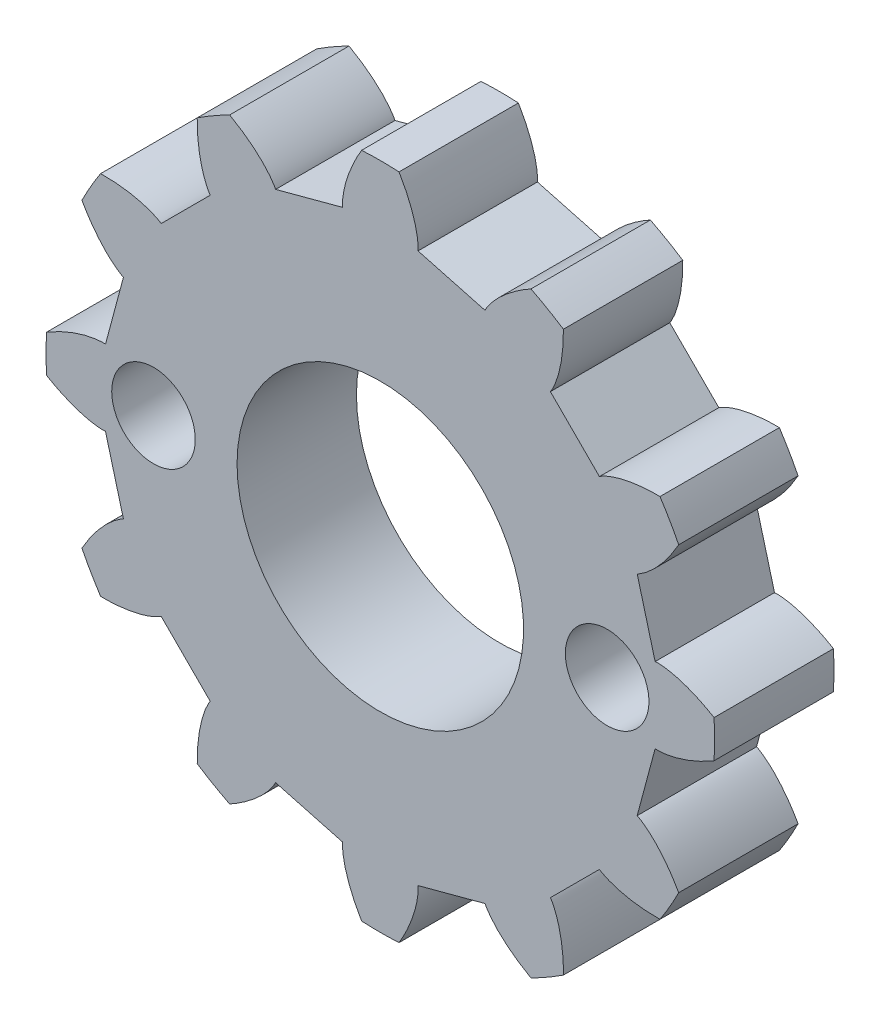
from build123d import *

# Parameters (mm, degrees)
SKETCH1_W               = 14
SKETCH1_H               = 5
CUT_EXTRUDE2_DEPTH      = 6
CIRPATTERN1_COUNT       = 12
CUT_EXTRUDE4_DEPTH      = 7
CUT_EXTRUDE4_DEPTH_BACK = 7
SKETCH3_R               = 6
SKETCH3_R_2             = 1.75


with BuildPart() as part:
    # Sketch1 → Revolve1 (revolve)
    with BuildSketch(Plane(origin=(0, 0, 0), x_dir=(1, 0, 0), z_dir=(0, 1, 0))):
        with Locations((7, -2.5)):
            Rectangle(SKETCH1_W, SKETCH1_H)
    revolve(axis=Axis((0, 0, 1), (0, 0, 1)))

    # Sketch2 → Cut-Extrude2 (cut, symmetric)
    with BuildSketch(Plane.XY):
        with BuildLine():
            add(Edge.make_bspline(
                [(11.509794645, 1.580267483), (11.513649577, 1.58074099), (11.524482374, 1.581899197), (11.545040271, 1.583417613), (11.578673885, 1.584939637), (11.621640783, 1.585473177), (11.677272094, 1.58454666), (11.742898568, 1.581376048), (11.815076545, 1.575712999), (11.893622206, 1.56720183), (11.971967533, 1.556633666), (12.050075991, 1.544160387), (12.127824076, 1.529994452), (12.221897823, 1.510781841), (12.334535508, 1.484891422), (12.465863184, 1.450486577), (12.614354754, 1.406585856), (12.765087082, 1.356650882), (12.912870643, 1.303254669), (13.061452614, 1.244438209), (13.204685667, 1.184082676), (13.352570159, 1.116449268), (13.488631947, 1.05150154), (13.639954485, 0.973312665), (13.761758266, 0.908625047), (13.886564813, 0.837313837), (13.947154846, 0.801945656), (13.978053561, 0.78359275)],
                knots=[2.5e-08, 2.5e-08, 2.5e-08, 2.5e-08, 2.5e-08, 0.005376749, 0.015083688, 0.02853182, 0.04661014, 0.064854849, 0.092110525, 0.119476176, 0.146842496, 0.174208854, 0.201574956, 0.228941013, 0.256307345, 0.307035032, 0.361767352, 0.416499661, 0.471231937, 0.525964282, 0.580696616, 0.635428982, 0.690161387, 0.744893688, 0.799626082, 0.854358408, 0.909090932, 0.909090932, 0.909090932, 0.909090932, 0.909090932], degree=4))
            add(Edge.make_bspline(
                [(13.978053561, 0.78359275), (14.552796942, 0.815812142), (15.669145229, 0.878393273), (18.676568536, 1.046985775), (20.905715815, 1.171949067), (24.231493422, 1.358388125), (26.780700493, 1.501293581), (29.542274367, 1.656104062), (31.85108462, 1.785533164), (34.272002701, 1.921246895), (36.589305557, 2.051152082), (38.979012727, 2.185116167), (41.345689012, 2.317789168), (43.584914052, 2.443317408), (45.771704582, 2.565906232), (47.819138341, 2.680682885), (49.738724778, 2.788292571), (51.542013805, 2.889382767), (53.306863976, 2.988318126), (54.763267689, 3.069962352), (56.42798926, 3.163284623), (57.609113149, 3.229496996), (59.014479317, 3.308280118), (59.581989126, 3.34009403), (59.905824187, 3.35824783)],
                knots=[0.083333333, 0.083333333, 0.083333333, 0.083333333, 0.083333333, 0.133389614, 0.184399802, 0.242015797, 0.296483898, 0.342668905, 0.388178228, 0.431557158, 0.47049247, 0.51459478, 0.558617598, 0.603642018, 0.642942995, 0.676973634, 0.717013889, 0.753119277, 0.780567956, 0.81054449, 0.840687958, 0.866681929, 0.88846281, 0.916666667, 0.916666667, 0.916666667, 0.916666667, 0.916666667], degree=4))
            add(Edge.make_bspline(
                [(59.905824187, 3.35824783), (59.898967791, 3.480555087), (59.884276336, 3.725468848), (59.847233627, 4.309040306), (59.809100404, 4.783373046), (59.755229129, 5.435549269), (59.701559503, 5.981191957), (59.638601048, 6.589752226), (59.572034189, 7.159755005), (59.498507768, 7.751358683), (59.41994969, 8.329731781), (59.314220697, 9.059347662), (59.176123254, 9.929150916), (58.998380892, 10.943523417), (58.77252213, 12.097343477), (58.524247729, 13.246943123), (58.253195349, 14.391604883), (57.960269702, 15.530000537), (57.644239062, 16.66393558), (57.307452375, 17.788817065), (56.946364624, 18.911335324), (56.567166837, 20.019166966), (56.160033919, 21.131575399), (55.741583374, 22.215568594), (55.284609852, 23.324904517), (54.835737132, 24.367184365), (54.377030446, 25.365076998), (54.047150754, 26.063113209), (53.722661816, 26.718514901), (53.614305327, 26.935234738), (53.559089512, 27.044584128)],
                knots=[0.083333333, 0.083333333, 0.083333333, 0.083333333, 0.083333333, 0.103174603, 0.123015873, 0.142857142, 0.162698412, 0.182539682, 0.202380952, 0.222222222, 0.242063492, 0.261904762, 0.281746031, 0.321428571, 0.361111111, 0.400793651, 0.44047619, 0.48015873, 0.51984127, 0.55952381, 0.599206349, 0.638888889, 0.678571429, 0.718253969, 0.757936508, 0.797619048, 0.837301588, 0.876984127, 0.896825397, 0.916666667, 0.916666667, 0.916666667, 0.916666667, 0.916666667], degree=4))
            add(Edge.make_bspline(
                [(53.559089512, 27.044584128), (53.330145048, 26.928978955), (52.841963443, 26.682472365), (51.537063266, 26.023564924), (50.253371485, 25.375366631), (48.359928383, 24.419275298), (46.514998526, 23.487680657), (44.45817195, 22.449089078), (42.449917364, 21.435023853), (40.435551954, 20.417872977), (38.498316767, 19.439668894), (36.616802919, 18.489601221), (34.772592824, 17.558370022), (32.964732545, 16.645493611), (31.043854411, 15.675548999), (29.199101678, 14.744043797), (27.196699379, 13.732933676), (25.182264884, 12.715747915), (22.909582824, 11.568160423), (20.862788623, 10.534634677), (18.19678724, 9.188441166), (16.405327121, 8.283845991), (13.971005088, 7.054638631), (12.992392517, 6.56048964), (12.497145885, 6.310415576)],
                knots=[0.083333333, 0.083333333, 0.083333333, 0.083333333, 0.083333333, 0.105635684, 0.130742521, 0.167467949, 0.204861111, 0.247818732, 0.287660256, 0.330172721, 0.370459402, 0.409855769, 0.445690883, 0.482638889, 0.520032051, 0.557202635, 0.600382835, 0.634615385, 0.678952991, 0.726696047, 0.774439103, 0.81784188, 0.86842281, 0.916666667, 0.916666667, 0.916666667, 0.916666667, 0.916666667], degree=4))
            add(Edge.make_bspline(
                [(10.757908325, 4.386345561), (10.761483548, 4.387862959), (10.771444129, 4.392276321), (10.790006998, 4.401240282), (10.819895574, 4.416738977), (10.857372769, 4.437760367), (10.905087639, 4.46637841), (10.960336527, 4.501937477), (11.020012963, 4.54293081), (11.083779917, 4.589574529), (11.146344879, 4.637899492), (11.207752148, 4.687755896), (11.268000998, 4.738897998), (11.339864947, 4.802573481), (11.424466834, 4.881314084), (11.520997515, 4.976773392), (11.627644626, 5.089038317), (11.733215164, 5.207649437), (11.834501376, 5.327783694), (11.933768908, 5.453011228), (12.027634604, 5.576897179), (12.121889627, 5.709411675), (12.207248728, 5.833688951), (12.299203453, 5.977063772), (12.372344813, 6.093986783), (12.444774848, 6.218147376), (12.479563265, 6.279072136), (12.497145885, 6.310415576)],
                knots=[0, 0, 0, 0, 0, 0.005376749, 0.015083688, 0.02853182, 0.04661014, 0.064854849, 0.092110525, 0.119476176, 0.146842496, 0.174208854, 0.201574956, 0.228941013, 0.256307345, 0.307035032, 0.361767352, 0.416499661, 0.471231937, 0.525964282, 0.580696616, 0.635428982, 0.690161387, 0.744893688, 0.799626082, 0.854358408, 0.909090915, 0.909090915, 0.909090915, 0.909090915, 0.909090915], degree=4))
            add(Edge.make_bspline(
                [(10.757908325, 4.386345561), (10.765403377, 4.358373648), (10.778593812, 4.309146272), (10.811288306, 4.187128762), (10.838074705, 4.087160559), (10.87418155, 3.952407978), (10.906405299, 3.832147309), (10.943234651, 3.694698296), (10.976858571, 3.569212117), (11.010064381, 3.445286349), (11.04164692, 3.327418709), (11.074098619, 3.206307319), (11.106783746, 3.084324762), (11.141528858, 2.95465424), (11.178253418, 2.817596315), (11.214411381, 2.682652959), (11.252887213, 2.539059202), (11.292924414, 2.389638331), (11.335623154, 2.230284465), (11.372317466, 2.093339429), (11.417158121, 1.925991827), (11.446833607, 1.815241404), (11.486030451, 1.66895679), (11.501394129, 1.611618765), (11.509794645, 1.580267483)],
                knots=[0.083333333, 0.083333333, 0.083333333, 0.083333333, 0.083333333, 0.123206654, 0.154566354, 0.191363324, 0.229805784, 0.266721993, 0.307549222, 0.348424145, 0.382796602, 0.411715888, 0.448647996, 0.491796398, 0.5277587, 0.566153465, 0.61051015, 0.65388908, 0.695217109, 0.748922085, 0.790536287, 0.83141121, 0.871976114, 0.916666667, 0.916666667, 0.916666667, 0.916666667, 0.916666667], degree=4))
        make_face()
    cut_extrude2 = extrude(amount=CUT_EXTRUDE2_DEPTH, both=True, mode=Mode.SUBTRACT)

    # CirPattern1: Cut-Extrude2 ×12 about axis
    cirpattern1_axis = Axis((0, 0, -0.25), (0, 0, 1))
    for i in range(1, CIRPATTERN1_COUNT):
        add(cut_extrude2.rotate(cirpattern1_axis, i * 360 / CIRPATTERN1_COUNT), mode=Mode.SUBTRACT)

    # Sketch3 → Cut-Extrude4 (cut, two sides: drawn at the far end of the back side and taken through both)
    with BuildSketch(Plane.XY.offset(-CUT_EXTRUDE4_DEPTH_BACK)):
        Circle(SKETCH3_R)
        with Locations((9.5, 0)):
            Circle(SKETCH3_R_2)
        with Locations((-9.5, 0)):
            Circle(SKETCH3_R_2)
    extrude(amount=CUT_EXTRUDE4_DEPTH + CUT_EXTRUDE4_DEPTH_BACK, mode=Mode.SUBTRACT)


solid = part.part
